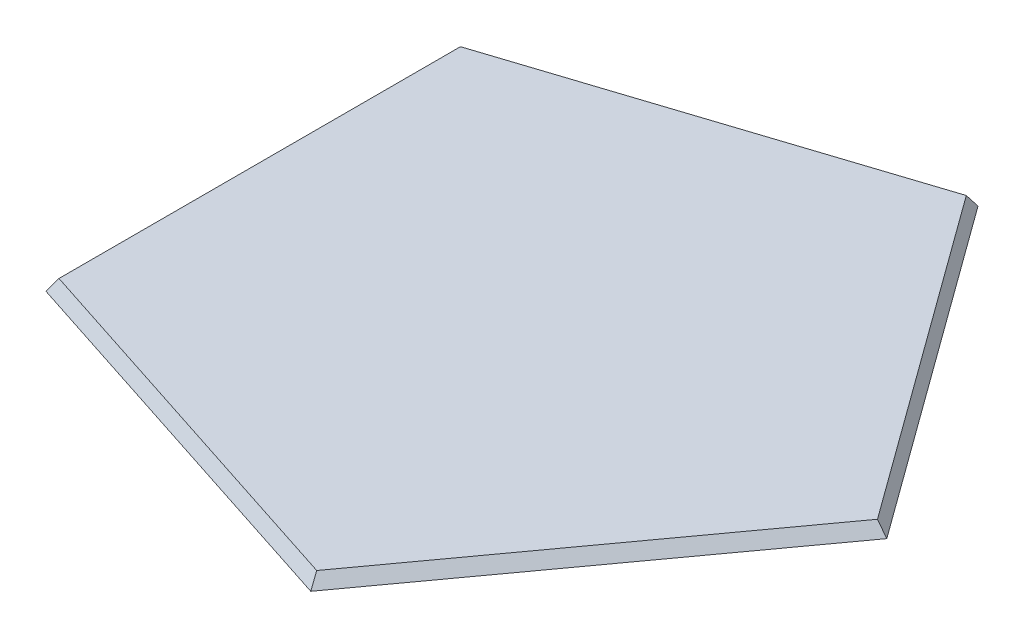
from build123d import *
from OCP.BRepFilletAPI import BRepFilletAPI_MakeChamfer

# Parameters (mm, degrees)
BOSS_EXTRUDE1_DEPTH = 3
CHAMFER1_SIZE       = 3
CHAMFER1_SIZE_2     = 1.853922924


with BuildPart() as part:
    # Sketch1 → Boss-Extrude1 (new body)
    with BuildSketch(Plane(origin=(0, 0, 0), x_dir=(1, 0, 0), z_dir=(0, 1, 0))):
        Polygon((86.524758425, 0), (26.737620788, 82.289935321), (-70, 50.85797696), (-70, -50.85797696), (26.737620788, -82.289935321), align=None)
    extrude(amount=BOSS_EXTRUDE1_DEPTH)

    # Chamfer1
    chamfer1_edges_1 = [part.edges().sort_by_distance(p)[0] for p in [
        (-70, 3, 0),
    ]]
    chamfer1_side_1 = [part.faces().sort_by_distance(p)[0] for p in [
        (-70, 2.962921542, 0),
    ]]
    chamfer1_edges_2 = [part.edges().sort_by_distance(p)[0] for p in [
        (-21.631189606, 3, -66.573956141),
    ]]
    chamfer1_side_2 = [part.faces().sort_by_distance(p)[0] for p in [
        (-21.631189606, 2.962921542, -66.573956141),
    ]]
    chamfer1_edges_3 = [part.edges().sort_by_distance(p)[0] for p in [
        (56.631189606, 3, -41.14496766),
    ]]
    chamfer1_side_3 = [part.faces().sort_by_distance(p)[0] for p in [
        (56.631189606, 2.962921542, -41.14496766),
    ]]
    chamfer1_edges_4 = [part.edges().sort_by_distance(p)[0] for p in [
        (56.631189606, 3, 41.14496766),
    ]]
    chamfer1_side_4 = [part.faces().sort_by_distance(p)[0] for p in [
        (56.631189606, 2.962921542, 41.14496766),
    ]]
    chamfer1_edges_5 = [part.edges().sort_by_distance(p)[0] for p in [
        (-21.631189606, 3, 66.573956141),
    ]]
    chamfer1_side_5 = [part.faces().sort_by_distance(p)[0] for p in [
        (-21.631189606, 2.962921542, 66.573956141),
    ]]
    chamfer1 = BRepFilletAPI_MakeChamfer(part.part.solid().wrapped)
    for e in chamfer1_edges_1:
        chamfer1.Add(CHAMFER1_SIZE - 0.0001, CHAMFER1_SIZE_2 - 0.0001, e.wrapped, chamfer1_side_1[0].wrapped)
    for e in chamfer1_edges_2:
        chamfer1.Add(CHAMFER1_SIZE - 0.0001, CHAMFER1_SIZE_2 - 0.0001, e.wrapped, chamfer1_side_2[0].wrapped)
    for e in chamfer1_edges_3:
        chamfer1.Add(CHAMFER1_SIZE - 0.0001, CHAMFER1_SIZE_2 - 0.0001, e.wrapped, chamfer1_side_3[0].wrapped)
    for e in chamfer1_edges_4:
        chamfer1.Add(CHAMFER1_SIZE - 0.0001, CHAMFER1_SIZE_2 - 0.0001, e.wrapped, chamfer1_side_4[0].wrapped)
    for e in chamfer1_edges_5:
        chamfer1.Add(CHAMFER1_SIZE - 0.0001, CHAMFER1_SIZE_2 - 0.0001, e.wrapped, chamfer1_side_5[0].wrapped)
    add(Compound.cast(chamfer1.Shape()), mode=Mode.REPLACE)  # a hair under: the kernel refuses the full size


solid = part.part
